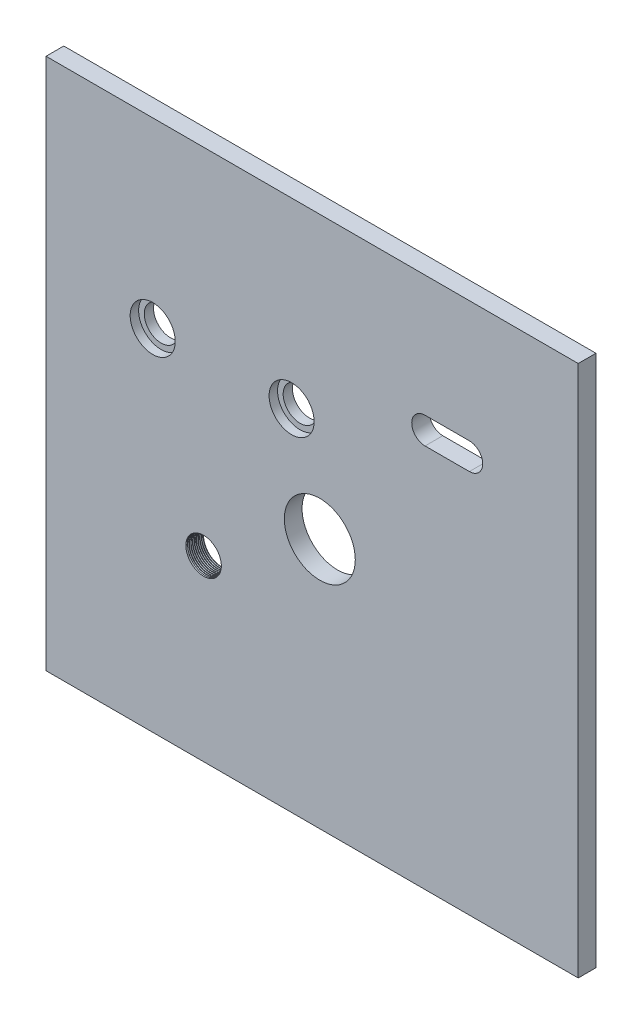
from build123d import *

# Parameters (mm, degrees)
SKETCH1_W                                      = 300
SKETCH1_H                                      = 300
BOSS_EXTRUDE1_DEPTH                            = 10
CBORE_FOR_3_4_STANDARD_LEADER_PIN1_D           = 19.05
CBORE_FOR_3_4_STANDARD_LEADER_PIN1_CBORE_D     = 25.4
CBORE_FOR_3_4_STANDARD_LEADER_PIN1_CBORE_DEPTH = 4.7625
SKETCH4_R                                      = 10
SKETCH4_R_2                                    = 20
CUT_EXTRUDE1_DEPTH                             = 10
THREAD1_PITCH                                  = 1


with BuildPart() as part:
    # Sketch1 → Boss-Extrude1 (new body)
    with BuildSketch(Plane.XY):
        with Locations((-150, 150)):
            Rectangle(SKETCH1_W, SKETCH1_H)
    extrude(amount=BOSS_EXTRUDE1_DEPTH)

    # CBORE for 3/4 Standard Leader Pin1 (through all)
    with Locations(Plane.XY.offset(10)):
        with Locations((-239.87514105, 197.162202729), (-161.568087462, 197.162202729)):
            CounterBoreHole(CBORE_FOR_3_4_STANDARD_LEADER_PIN1_D / 2, CBORE_FOR_3_4_STANDARD_LEADER_PIN1_CBORE_D / 2, CBORE_FOR_3_4_STANDARD_LEADER_PIN1_CBORE_DEPTH)

    # Sketch4 → Cut-Extrude1 (cut)
    with BuildSketch(Plane.XY.offset(10)):
        with Locations((-211.177385616, 100.563728795)):
            Circle(SKETCH4_R)
        with Locations((-145.67432627, 141.348652539)):
            Circle(SKETCH4_R_2)
        with BuildLine():
            Line((-86.350800824, 231.569847487), (-61.350800824, 231.569847487))
            ThreePointArc((-61.350800824, 231.569847487), (-53.850800824, 224.069847487), (-61.350800824, 216.569847487))
            Line((-61.350800824, 216.569847487), (-86.350800824, 216.569847487))
            ThreePointArc((-86.350800824, 216.569847487), (-93.850800824, 224.069847487), (-86.350800824, 231.569847487))
        make_face()
    extrude(amount=-CUT_EXTRUDE1_DEPTH, mode=Mode.SUBTRACT)

    # Thread1: the profile of Thread Profile1 profile screwed along a right-hand helix of 10 turns, 8 arcs to a turn; built about Z, then put on its axis
    thread1_z = Axis((0, 0, 0), (0, 0, 1))
    thread1_corners = [(9.9997, 0, -0.000173205), (10.541265875, 0, 0.312499999), (10.541265875, 0, 0.437499999), (9.9997, 0, 0.750173202)]
    with BuildLine(mode=Mode.PRIVATE) as thread1_profile:
        Line(thread1_corners[0], thread1_corners[1])
        Line(thread1_corners[1], thread1_corners[2])
        Line(thread1_corners[2], thread1_corners[3])
        Line(thread1_corners[3], thread1_corners[0])
    thread1_cap = Face(thread1_profile.wire())
    thread1_turn_angles = [0, 22.5, 45, 67.5, 90, 112.5, 135, 157.5, 180, 202.5, 225, 247.5, 270, 292.5, 315, 337.5, 360]
    thread1_turn_weights = [1, 0.9238795325112867, 1, 0.9238795325112867, 1, 0.9238795325112867, 1, 0.9238795325112867, 1, 0.9238795325112867, 1, 0.9238795325112867, 1, 0.9238795325112867, 1, 0.9238795325112867, 1]
    thread1_turn_rails = [Edge.make_bspline([Vector(p[0], p[1], 0).rotate(thread1_z, thread1_turn_angles[k]) / thread1_turn_weights[k] + Vector(0, 0, p[2] + THREAD1_PITCH * thread1_turn_angles[k] / 360) for k in range(17)], [0, 0, 0, 1, 1, 2, 2, 3, 3, 4, 4, 5, 5, 6, 6, 7, 7, 8, 8, 8], 2, thread1_turn_weights) for p in thread1_corners]
    thread1_turn_sides = [Face.make_surface_from_curves(thread1_turn_rails[p[0]], thread1_turn_rails[p[1]]) for p in [(0, 1), (1, 2), (2, 3), (3, 0)]]
    thread1 = Plane(origin=(-211.177385616, 100.563728795, 10), x_dir=(-1, 0, 0), z_dir=(0, 0, -1)) * Solid(Shell([*[p.moved(Location((0, 0, THREAD1_PITCH * i))) for i in range(10) for p in thread1_turn_sides], thread1_cap, thread1_cap.rotate(thread1_z, 3600).moved(Location((0, 0, THREAD1_PITCH * 3600 / 360)))]))
    add(thread1, mode=Mode.SUBTRACT)


solid = part.part
